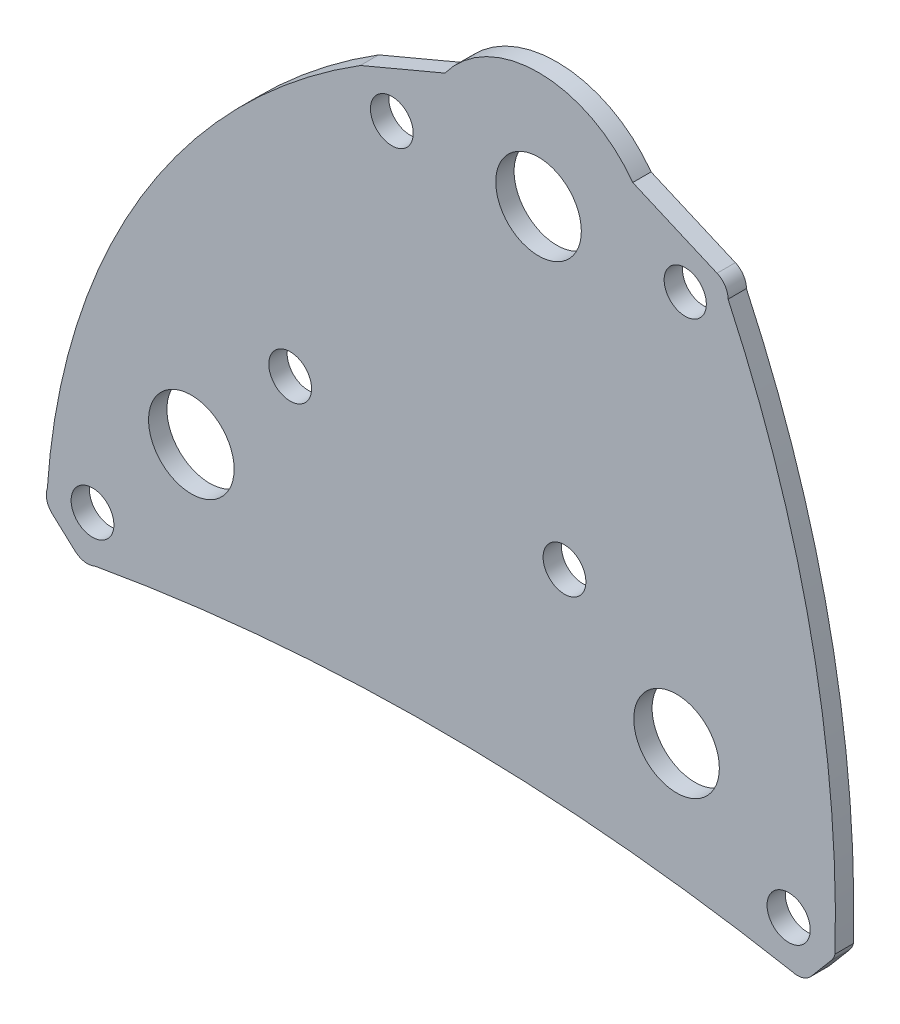
from build123d import *

# Parameters (mm, degrees)
SKETCH1_W           = 130
SKETCH1_H           = 110
BOSS_EXTRUDE1_DEPTH = 3
SKETCH2_W           = 130
SKETCH2_H           = 110
CUT_EXTRUDE1_DEPTH  = 10
SKETCH3_R           = 7
SKETCH3_R_2         = 3.451349814
SKETCH3_R_3         = 3.5
SKETCH3_R_4         = 3.533852352
CUT_EXTRUDE2_DEPTH  = 10


with BuildPart() as part:
    # Sketch1 → Boss-Extrude1 (new body)
    with BuildSketch(Plane.XY):
        Rectangle(SKETCH1_W, SKETCH1_H)
    extrude(amount=BOSS_EXTRUDE1_DEPTH)

    # Sketch2 → Cut-Extrude1 (cut)
    with BuildSketch(Plane.XY.offset(3)):
        Rectangle(SKETCH2_W, SKETCH2_H)
        with BuildLine():
            Line((-59.47576544, -53.607140846), (-63.198422227, -50.212423413))
            ThreePointArc((-63.198422227, -50.212423413), (-64.085317487, -48.731662044), (-64.00947903, -47.007282166))
            ThreePointArc((-64.00947903, -47.007282166), (-48.705948363, 1.925420221), (-12.800867901, 38.52367989))
            Line((-12.800867901, 38.52367989), (1.038853263, 44.361019449))
            ThreePointArc((1.038853263, 44.361019449), (16.438302804, 52.115303468), (31.767912546, 44.223850371))
            Line((31.767912546, 44.223850371), (45.554969528, 38.263189769))
            ThreePointArc((45.554969528, 38.263189769), (46.875270988, 37.151415741), (47.364426614, 35.496132017))
            ThreePointArc((47.364426614, 35.496132017), (60.992088303, -5.514592593), (64.85831391, -48.556955395))
            ThreePointArc((64.85831391, -48.556955395), (64.618469123, -49.190526824), (64.242583482, -49.754129754))
            Line((64.242583482, -49.754129754), (60.991812848, -53.603125765))
            ThreePointArc((60.991812848, -53.603125765), (59.545831313, -54.545662148), (57.819814936, -54.535420134))
            ThreePointArc((57.819814936, -54.535420134), (0.823909158, -49.163408252), (-56.209622322, -54.120027458))
            ThreePointArc((-56.209622322, -54.120027458), (-57.919722192, -54.354112628), (-59.47576544, -53.607140846))
        make_face(mode=Mode.SUBTRACT)
    extrude(amount=-CUT_EXTRUDE1_DEPTH, mode=Mode.SUBTRACT)

    # Sketch3 → Cut-Extrude2 (cut)
    with BuildSketch(Plane.XY.offset(3)):
        with Locations((16.353491015, 33.115492759)):
            Circle(SKETCH3_R)
        with Locations((40.35325191, 33.008362077)):
            Circle(SKETCH3_R_2)
        with Locations((-7.64626988, 33.222623441)):
            Circle(SKETCH3_R_3)
        with Locations((-40.448942317, -29.003775794)):
            Circle(SKETCH3_R)
        with Locations((-56.620414459, -46.737458118)):
            Circle(SKETCH3_R_3)
        with Locations((-24.277470176, -11.27009347)):
            Circle(SKETCH3_R_3)
        with Locations((20.598283056, -16.190449825)):
            Circle(SKETCH3_R_3)
        with Locations((38.933809649, -31.676200196)):
            Circle(SKETCH3_R)
        with Locations((57.269336242, -47.161950568)):
            Circle(SKETCH3_R_4)
    extrude(amount=-CUT_EXTRUDE2_DEPTH, mode=Mode.SUBTRACT)


solid = part.part
